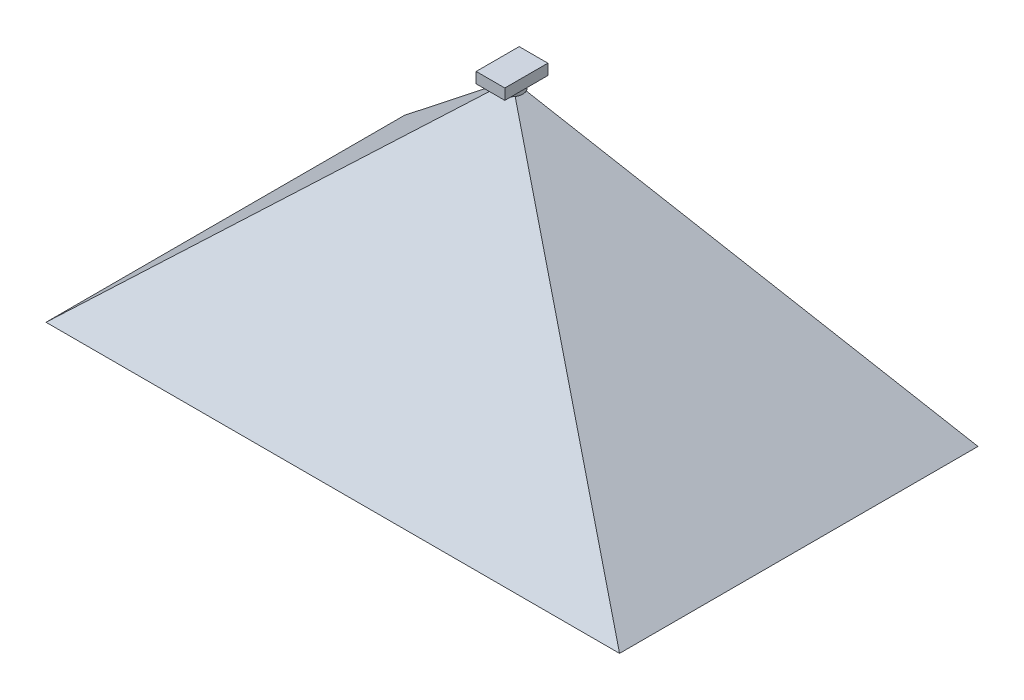
from build123d import *

# Parameters (mm, degrees)
SKETCH3_R           = 3.81
CAMERA_LENS_DEPTH   = 2.54
SKETCH4_W           = 10.16
SKETCH4_H           = 15.24
CAMERA_HOLDER_DEPTH = 3.81


with BuildPart() as part:
    # Sketch2 → FOV section 0
    with BuildSketch(Plane(origin=(0, 90.932, 0), x_dir=(1, 0, 0), z_dir=(0, 1, 0))):
        with BuildLine():
            Line((-2.755394972, -1.722121857), (2.755394972, -1.722121857))
            Line((2.755394972, -1.722121857), (2.755394972, 1.722121857))
            Line((2.755394972, 1.722121857), (-2.755394972, 1.722121857))
            Line((-2.755394972, 1.722121857), (-2.755394972, -1.722121857))
        make_face()
    # Sketch1 → FOV section 1
    with BuildSketch(Plane(origin=(0, 0, 0), x_dir=(1, 0, 0), z_dir=(0, 1, 0))):
        with BuildLine():
            Line((-101.6, -63.5), (101.6, -63.5))
            Line((101.6, -63.5), (101.6, 63.5))
            Line((101.6, 63.5), (-101.6, 63.5))
            Line((-101.6, 63.5), (-101.6, -63.5))
        make_face()
    loft()

    # Sketch3 → camera lens (add)
    with BuildSketch(Plane(origin=(0, 90.932, 0), x_dir=(1, 0, 0), z_dir=(0, 1, 0))):
        Circle(SKETCH3_R)
    extrude(amount=CAMERA_LENS_DEPTH)

    # Sketch4 → camera holder (add)
    with BuildSketch(Plane(origin=(0, 93.472, 0), x_dir=(1, 0, 0), z_dir=(0, 1, 0))):
        Rectangle(SKETCH4_W, SKETCH4_H)
    extrude(amount=CAMERA_HOLDER_DEPTH)


solid = part.part
